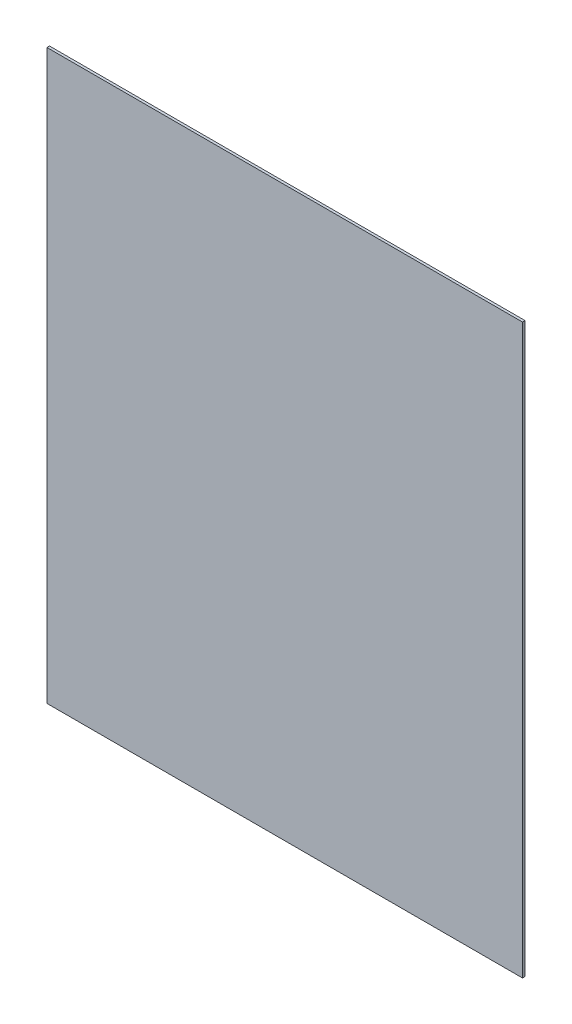
from build123d import *

# Parameters (mm, degrees)
CROQUIS1_W            = 501.26
CROQUIS1_H            = 352.34
BRIDA_BASE1_DEPTH     = 1.5875
CROQUIS2_W            = 206.32
CROQUIS2_H            = 110
CROQUIS2_H_2          = 918.56963319
CORTAR_EXTRUIR1_DEPTH = 10


# Sheet-metal steps are written as plain solids
with BuildPart() as part:
    # Croquis1 → Brida base1 (new body)
    with BuildSketch(Plane.XY):
        Rectangle(CROQUIS1_W, CROQUIS1_H)
    extrude(amount=-BRIDA_BASE1_DEPTH)

    # Croquis2 → Cortar-Extruir1 (cut)
    with BuildSketch(Plane.XY):
        Polygon((-250.63, 68.83), (-250.63, -68.83), (-250.63, -178.83), (-250.63, -1129.362643751), (-44.31, -1129.362643751), (-44.31, -178.83), (-44.31, -68.83), (-44.31, 68.83), align=None)
        with Locations((-147.47, 123.83)):
            Rectangle(CROQUIS2_W, CROQUIS2_H)
        with Locations((-147.47, 638.114816595)):
            Rectangle(CROQUIS2_W, CROQUIS2_H_2)
    extrude(amount=-CORTAR_EXTRUIR1_DEPTH, mode=Mode.SUBTRACT)


solid = part.part
